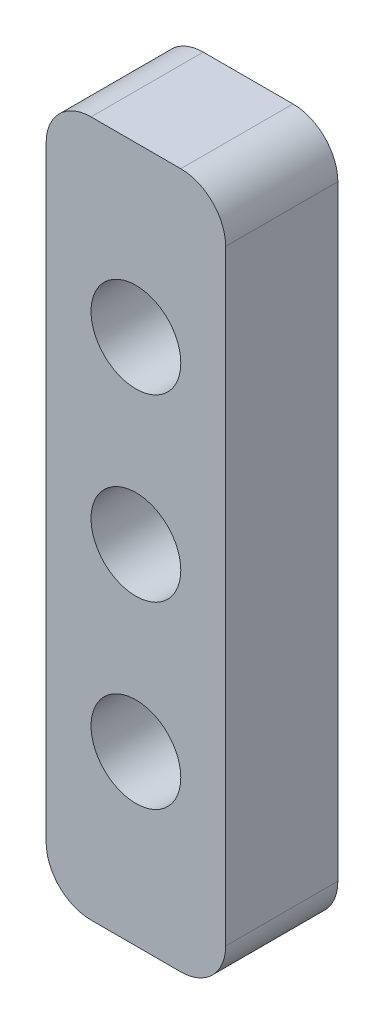
from build123d import *

# Parameters (mm, degrees)
BOSS_EXTRUDE1_DEPTH = 5
SKETCH3_R           = 2
CUT_EXTRUDE2_DEPTH  = 19.145247312


with BuildPart() as part:
    # Sketch1 → Boss-Extrude1 (new body)
    with BuildSketch(Plane.XY):
        with BuildLine():
            Line((0, -13.5), (0, 13.5))
            ThreePointArc((0, 13.5), (0.585786438, 14.914213562), (2, 15.5))
            Line((2, 15.5), (6, 15.5))
            ThreePointArc((6, 15.5), (7.414213562, 14.914213562), (8, 13.5))
            Line((8, 13.5), (8, -13.5))
            ThreePointArc((8, -13.5), (7.414213562, -14.914213562), (6, -15.5))
            Line((6, -15.5), (2, -15.5))
            ThreePointArc((2, -15.5), (0.585786438, -14.914213562), (0, -13.5))
        make_face()
    extrude(amount=BOSS_EXTRUDE1_DEPTH)

    # Sketch3 → Cut-Extrude2 (cut, through all)
    with BuildSketch(Plane.XY.offset(5)):
        with Locations((4, 0)):
            Circle(SKETCH3_R)
        with Locations((4, 8)):
            Circle(SKETCH3_R)
        with Locations((4, -8)):
            Circle(SKETCH3_R)
    extrude(amount=-CUT_EXTRUDE2_DEPTH, mode=Mode.SUBTRACT)


solid = part.part
